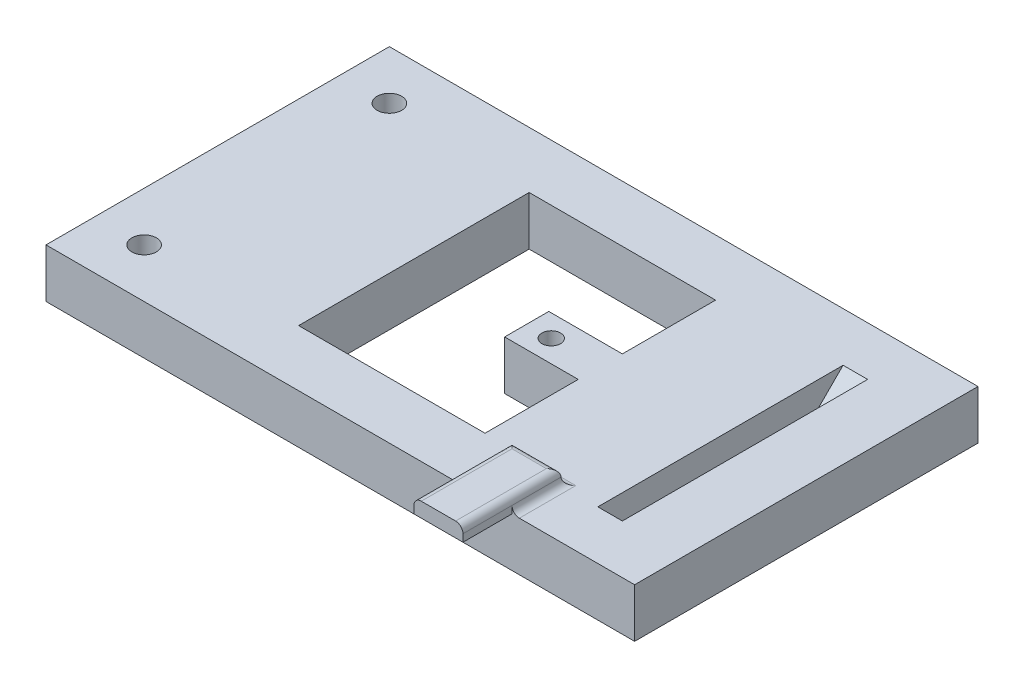
from build123d import *

# Parameters (mm, degrees)
SKETCH1_W           = 120
SKETCH1_H           = 70
SKETCH1_R           = 2.5
SKETCH1_R_2         = 1.9
SKETCH1_W_2         = 5
SKETCH1_H_2         = 30
BOSS_EXTRUDE1_DEPTH = 10
CHAMFER1_SIZE       = 10
SKETCH3_W           = 10
SKETCH3_H           = 20
BOSS_EXTRUDE2_DEPTH = 3
FILLET1_R           = 1.5


with BuildPart() as part:
    # Sketch1 → Boss-Extrude1 (new body)
    with BuildSketch(Plane(origin=(0, 0, 0), x_dir=(1, 0, 0), z_dir=(0, 1, 0))):
        Rectangle(SKETCH1_W, SKETCH1_H)
        with Locations(Location((-50, 25, 0), (0, 0, 270))):
            Circle(SKETCH1_R, mode=Mode.SUBTRACT)
        with Locations(Location((-50, -25, 0), (0, 0, 90))):
            Circle(SKETCH1_R, mode=Mode.SUBTRACT)
        with Locations(Location((8, 0, 0), (0, 0, 270))):
            Circle(SKETCH1_R_2, mode=Mode.SUBTRACT)
        Polygon((18, 23.5), (18, 4.5), (3, 4.5), (3, -4.5), (18, -4.5), (18, -23.5), (-20, -23.5), (-20, 23.5), align=None, mode=Mode.SUBTRACT)
        with Locations((45, 0)):
            Rectangle(SKETCH1_W_2, SKETCH1_H_2, mode=Mode.SUBTRACT)
    extrude(amount=BOSS_EXTRUDE1_DEPTH)

    # Chamfer1
    chamfer1_edges = [part.edges().sort_by_distance(p)[0] for p in [
        (45, 10, 15),
        (45, 10, -15),
    ]]
    chamfer(chamfer1_edges, length=CHAMFER1_SIZE - 0.0001)  # a hair under: the kernel refuses the full size

    # Sketch3 → Boss-Extrude2 (add)
    with BuildSketch(Plane(origin=(0, 10, 0), x_dir=(1, 0, 0), z_dir=(0, 1, 0))):
        with Locations((30, -35)):
            Rectangle(SKETCH3_W, SKETCH3_H)
    extrude(amount=BOSS_EXTRUDE2_DEPTH)

    # Fillet1
    fillet1_edges = [part.edges().sort_by_distance(p)[0] for p in [
        (25, 13, 35),
        (35, 13, 35),
        (30, 13, 25),
        (35, 10, 30),
        (30, 10, 25),
        (25, 10, 30),
    ]]
    fillet(fillet1_edges, radius=FILLET1_R - 0.0001)  # a hair under: the kernel refuses the full size


solid = part.part
